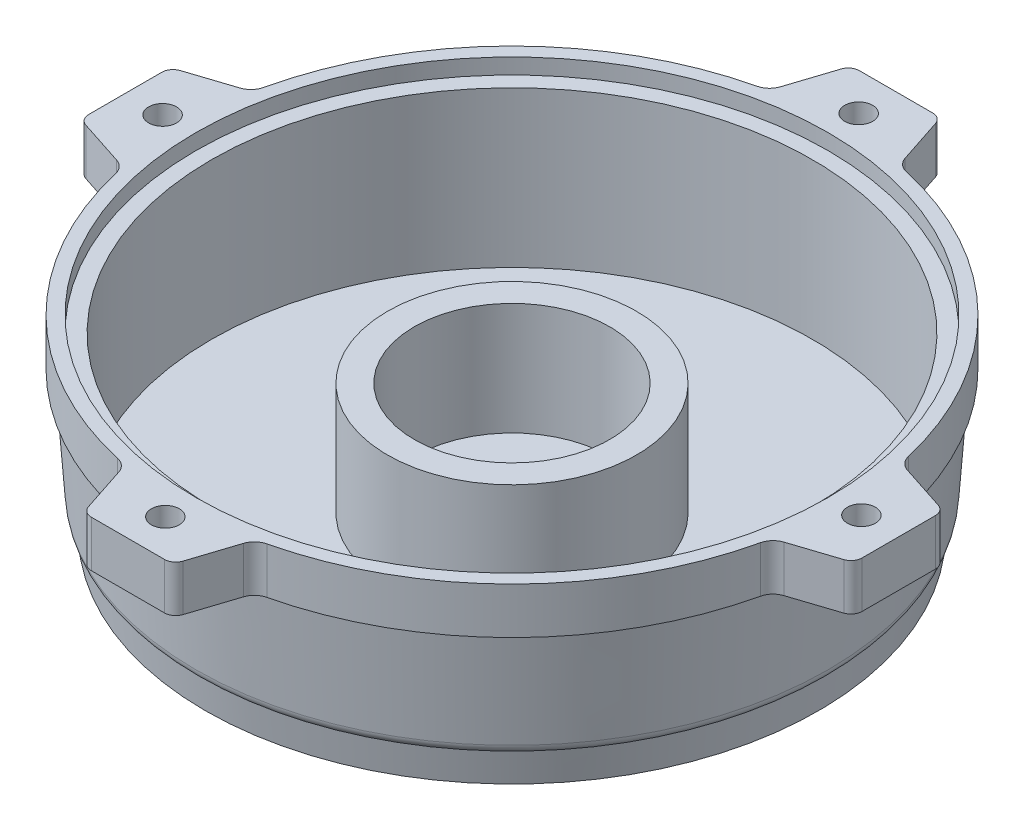
from build123d import *

# Parameters (mm, degrees)
BOSS_EXTRUDE2_DEPTH     = 8.3
CIRPATTERN1_COUNT       = 4
SKETCH13_R              = 22.4
CUT_EXTRUDE3_DEPTH      = 4
FILLET1_R               = 5
SKETCH15_R              = 18
SKETCH15_R_2            = 15
BOSS_EXTRUDE3_DEPTH     = 4
SKETCH16_R              = 7.5
CUT_EXTRUDE4_DEPTH      = 103.587698187
FILLET2_R               = 5
FILLET4_R               = 3
FILLET5_R               = 2
FILLET6_R               = 2
TAP_DRILL_FOR_M6_TAP1_D = 5


with BuildPart() as part:
    # Sketch1 → Revolve1 (revolve)
    with BuildSketch(Plane.XY, mode=Mode.PRIVATE) as revolve1_sk:
        Polygon((22.3, -26.9), (53.8, -26.9), (53.8, 0.95810827), (56.6, 0.95810827), (56.6, 3.75810827), (59, 3.75810827), (59, 0), (59, -31.9), (0, -31.9), (0, -26.9), (17.5, -26.9), (17.5, -6.8), (22.3, -6.8), align=None)
    revolve(revolve1_sk.sketch.rotate(Axis((0, -26.9, 0), (0, -1, 0)), 180), axis=Axis((0, -26.9, 0), (0, -1, 0)))

    # Sketch2 → Boss-Extrude2 (add)
    with BuildSketch(Plane(origin=(0, 3.75810827, 0), x_dir=(1, 0, 0), z_dir=(0, 1, 0))):
        Polygon((7.756499668, 69), (-8.243500332, 69), (-11.893500332, 57.788793462), (11.406499668, 57.88688768), align=None)
    boss_extrude2 = extrude(amount=-BOSS_EXTRUDE2_DEPTH)

    # CirPattern1: Boss-Extrude2 ×4 about axis
    cirpattern1_axis = Axis((0, 0, 0), (0, 1, 0))
    for i in range(1, CIRPATTERN1_COUNT):
        add(boss_extrude2.rotate(cirpattern1_axis, i * 360 / CIRPATTERN1_COUNT))

    # Sketch10 → Cut-Revolve4 (revolve, cut)
    with BuildSketch(Plane(origin=(0, 0, 0), x_dir=(0, 0, -1), z_dir=(1, 0, 0)), mode=Mode.PRIVATE) as cut_revolve4_sk:
        Polygon((59.74122217, -25.056663082), (55.637901582, -24.521737202), (54.676040662, -31.9), (59.74122217, -32.409345916), align=None)
    revolve(cut_revolve4_sk.sketch.rotate(Axis((0, -1.306352148, 0), (0, -1, 0)), 281.147212692), axis=Axis((0, -1.306352148, 0), (0, -1, 0)), mode=Mode.SUBTRACT)

    # Sketch8 → Cut-Revolve5 (revolve, cut)
    with BuildSketch(Plane(origin=(0, 0, 0), x_dir=(0, 0, -1), z_dir=(1, 0, 0)), mode=Mode.PRIVATE) as cut_revolve5_sk:
        Polygon((57.88688768, -4.54189173), (59, -4.54189173), (59, -31.9), (56, -31.9), align=None)
    revolve(cut_revolve5_sk.sketch.rotate(Axis((0, 5.358719866, 0), (0, -1, 0)), 180), axis=Axis((0, 5.358719866, 0), (0, -1, 0)), mode=Mode.SUBTRACT)

    # Sketch12 → Cut-Revolve6 (revolve, cut)
    with BuildSketch(Plane(origin=(0, 0, 0), x_dir=(0, 0, -1), z_dir=(1, 0, 0))):
        Polygon((-55.049732908, -31.9), (-54.904154696, -30.15017811), (-17.788536772, -31.9), align=None)
    revolve(axis=Axis((0, 13.859698408, 0), (0, -1, 0)), mode=Mode.SUBTRACT)

    # Sketch13 → Cut-Extrude3 (cut)
    with BuildSketch(Plane.XZ.offset(31.9)):
        Circle(SKETCH13_R)
    extrude(amount=-CUT_EXTRUDE3_DEPTH, mode=Mode.SUBTRACT)

    # Fillet1
    # the kernel refuses this fillet: 5 mm, written as the material it takes off along each edge
    with BuildSketch(Plane(origin=(0, -31.68259181, 0), x_dir=(0, 0, 1), z_dir=(1, 0, 0))) as fillet1_piece_1:
        with BuildLine():
            CenterArc((27.185563904, -5.231169776), FILLET1_R, 87.300779723, 75.858290504)
            Line((22.4, -3.78259181), (22.304288722, -3.753620251))
            ThreePointArc((22.304288722, -3.753620251), (22.3, -1.891295905), (22.3, 0))
            Line((22.3, 0), (22.404709286, 0.099889052))
            Line((22.404709286, 0.099889052), (27.425737475, -0.136828145))
            Line((27.425737475, -0.136828145), (27.421028189, -0.236717197))
        make_face()
    revolve(axis=Axis((0, -31.68259181, 0), (0, -1, 0)), revolution_arc=270, mode=Mode.SUBTRACT)
    with BuildSketch(Plane(origin=(0, -31.68259181, 0), x_dir=(1, 0, 0), z_dir=(0, 0, -1))) as fillet1_piece_2:
        with BuildLine():
            CenterArc((27.185563904, -5.231169776), FILLET1_R, 87.300779723, 75.858290504)
            Line((22.4, -3.78259181), (22.304288722, -3.753620251))
            ThreePointArc((22.304288722, -3.753620251), (22.3, -1.891295905), (22.3, 0))
            Line((22.3, 0), (22.404709286, 0.099889052))
            Line((22.404709286, 0.099889052), (27.425737475, -0.136828145))
            Line((27.425737475, -0.136828145), (27.421028189, -0.236717197))
        make_face()
    revolve(axis=Axis((0, -31.68259181, 0), (0, -1, 0)), revolution_arc=90, mode=Mode.SUBTRACT)

    # Sketch15 → Boss-Extrude3 (add)
    with BuildSketch(Plane.XZ.offset(27.9)):
        Circle(SKETCH15_R)
        Circle(SKETCH15_R_2, mode=Mode.SUBTRACT)
    extrude(amount=BOSS_EXTRUDE3_DEPTH)

    # Sketch16 → Cut-Extrude4 (cut, through all)
    with BuildSketch(Plane.XZ.offset(27.9)):
        Circle(SKETCH16_R)
    extrude(amount=-CUT_EXTRUDE4_DEPTH, mode=Mode.SUBTRACT)

    # Fillet2
    fillet2_edges = [part.edges().sort_by_distance(p)[0] for p in [
        (-22.4, -27.9, 0),
    ]]
    fillet(fillet2_edges, radius=FILLET2_R)

    # Fillet4
    fillet4_edges = [part.edges().sort_by_distance(p)[0] for p in [
        (11.406499668, -0.39189173, -57.88688768),
        (-11.893500332, -0.39189173, -57.788793462),
        (-57.88688768, -0.39189173, -11.406499668),
        (-57.788793462, -0.39189173, 11.893500332),
        (-11.406499668, -0.39189173, 57.88688768),
        (11.893500332, -0.39189173, 57.788793462),
        (57.88688768, -0.39189173, 11.406499668),
        (57.788793462, -0.39189173, -11.893500332),
    ]]
    fillet(fillet4_edges, radius=FILLET4_R)

    # Fillet5
    fillet5_edges = [part.edges().sort_by_distance(p)[0] for p in [
        (-8.243500332, -0.39189173, -69),
        (7.756499668, -0.39189173, -69),
        (-69, -0.39189173, 8.243500332),
        (-69, -0.39189173, -7.756499668),
        (8.243500332, -0.39189173, 69),
        (-7.756499668, -0.39189173, 69),
        (69, -0.39189173, -8.243500332),
        (69, -0.39189173, 7.756499668),
    ]]
    fillet(fillet5_edges, radius=FILLET5_R)

    # Fillet6
    # the kernel refuses this fillet: 2 mm, written as the material it takes off along each edge
    with BuildSketch(Plane(origin=(0, -24.634269562, 0), x_dir=(0, 0, 1), z_dir=(-1, 0, 0))) as fillet6_piece_1:
        with BuildLine():
            CenterArc((54.622986935, 1.835886142), FILLET6_R, 300.494611252, 55.559949074)
            Line((55.637901582, 0.112532359), (55.658199875, 0.078065284))
            ThreePointArc((55.658199875, 0.078065284), (56.064338554, 0.016601804), (56.495946338, -0.039664376))
            Line((56.495946338, -0.039664376), (56.541022351, -0.00275226))
            Line((56.541022351, -0.00275226), (56.658152184, 1.695520873))
            Line((56.658152184, 1.695520873), (56.618246983, 1.698273133))
        make_face()
    revolve(axis=Axis((0, -24.634269562, 0), (0, 1, 0)), revolution_arc=258.852787308, mode=Mode.SUBTRACT)
    with BuildSketch(Plane(origin=(0, -24.634269562, 0), x_dir=(-0.9811336895007642, 0, -0.1933305028354758), z_dir=(0.1933305028354758, 0, -0.9811336895007642))) as fillet6_piece_2:
        with BuildLine():
            CenterArc((54.622986935, 1.835886142), FILLET6_R, 300.494611252, 55.559949074)
            Line((55.637901582, 0.112532359), (55.658199875, 0.078065284))
            ThreePointArc((55.658199875, 0.078065284), (56.064338554, 0.016601804), (56.495946338, -0.039664376))
            Line((56.495946338, -0.039664376), (56.541022351, -0.00275226))
            Line((56.541022351, -0.00275226), (56.658152184, 1.695520873))
            Line((56.658152184, 1.695520873), (56.618246983, 1.698273133))
        make_face()
    revolve(axis=Axis((0, -24.634269562, 0), (0, 1, 0)), revolution_arc=101.147212692, mode=Mode.SUBTRACT)

    # Tap Drill for M6 Tap1 (through all)
    with Locations(Plane(origin=(0, 3.75810827, 0), x_dir=(1, 0, 0), z_dir=(0, 1, 0))):
        with Locations((-0.243500332, 62.31716076), (62.31716076, 0.243500332), (0.243500332, -62.31716076), (-62.31716076, -0.243500332)):
            Hole(TAP_DRILL_FOR_M6_TAP1_D / 2)


solid = part.part
